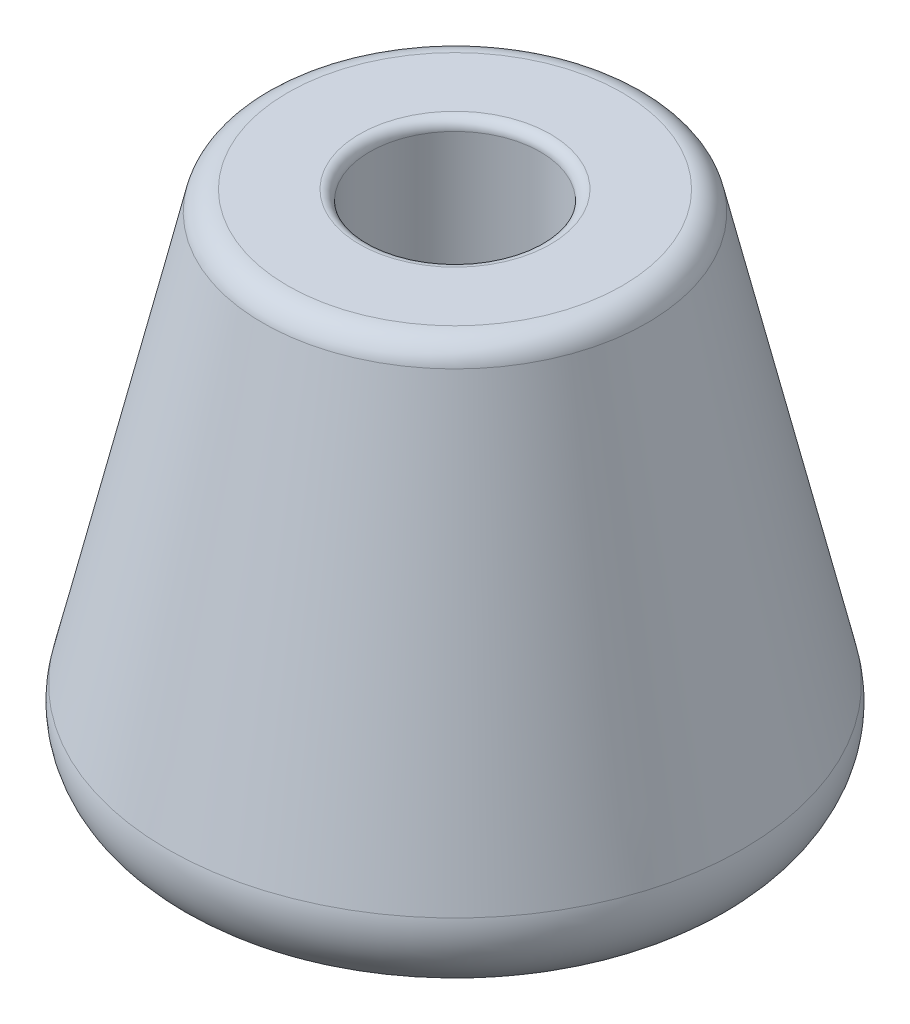
from build123d import *

# Parameters (mm, degrees)
ZAOKR_GLENIE3_R = 0.3
ZAOKR_GLENIE4_R = 0.75
ZAOKR_GLENIE5_R = 2


with BuildPart() as part:
    # Szkic1 → Obrót1 (revolve)
    with BuildSketch(Plane(origin=(0, 0, 0), x_dir=(0, 0, -1), z_dir=(1, 0, 0))):
        Polygon((0, 0), (9, 0), (5.5, 15), (2.5, 15), (2.5, 5), (0, 5), align=None)
    revolve(axis=Axis((0, 5, 0), (0, 1, 0)))

    # Zaokrąglenie3
    zaokr_glenie3_edges = [part.edges().sort_by_distance(p)[0] for p in [
        (0, 5, 2.5),
        (0, 15, 2.5),
    ]]
    fillet(zaokr_glenie3_edges, radius=ZAOKR_GLENIE3_R)

    # Zaokrąglenie4
    zaokr_glenie4_edges = [part.edges().sort_by_distance(p)[0] for p in [
        (0, 15, 5.5),
    ]]
    fillet(zaokr_glenie4_edges, radius=ZAOKR_GLENIE4_R)

    # Zaokrąglenie5
    zaokr_glenie5_edges = [part.edges().sort_by_distance(p)[0] for p in [
        (0, 0, 9),
    ]]
    fillet(zaokr_glenie5_edges, radius=ZAOKR_GLENIE5_R)


solid = part.part
